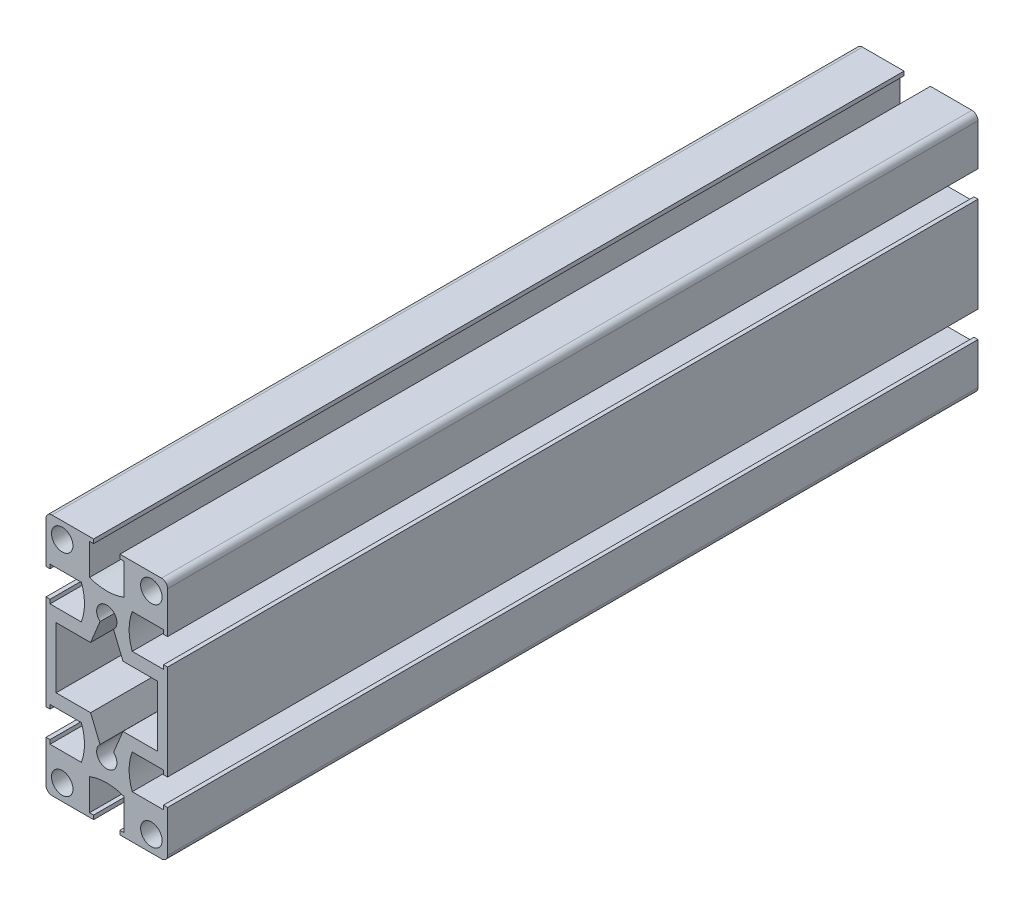
from build123d import *

# Parameters (mm, degrees)
SKETCH1_2_R                 = 2.65
EXTRUDE_1_DEPTH             = 200
HOLE_WIZARD_M5_1_AT_2_COUNT = 2
HOLE_WIZARD_M5_1_AT_2_PITCH = 30


# Read off the part's stored shape, not the designer's step: 30 x 60G x R1.5<1>
with BuildPart() as part:
    # Sketch1<2> → 凸台-拉伸1 (new body)
    with BuildSketch(Plane(origin=(1.902137601, -4.901792835, 0), x_dir=(1, 0, 0), z_dir=(0, 0, 1))):
        with BuildLine():
            Line((-3.25, 30), (-3.25, 29))
            Line((-3.25, 29), (-4.25, 29))
            Line((-4.25, 29), (-4.25, 21.277812156))
            ThreePointArc((-4.25, 21.277812156), (0, 20.5), (4.25, 21.277812156))
            Line((4.25, 21.277812156), (4.25, 29))
            Line((4.25, 29), (3.25, 29))
            Line((3.25, 29), (3.25, 30))
            Line((3.25, 30), (13.5, 30))
            ThreePointArc((13.5, 30), (14.560660172, 29.560660172), (15, 28.5))
            Line((15, 28.5), (15, 18.25))
            Line((15, 18.25), (14, 18.25))
            Line((14, 18.25), (14, 19.25))
            Line((14, 19.25), (6.277812156, 19.25))
            ThreePointArc((6.277812156, 19.25), (5.5, 15), (6.277812156, 10.75))
            Line((6.277812156, 10.75), (14, 10.75))
            Line((14, 10.75), (14, 11.75))
            Line((14, 11.75), (15, 11.75))
            Line((15, 11.75), (15, -11.75))
            Line((15, -11.75), (14, -11.75))
            Line((14, -11.75), (14, -10.75))
            Line((14, -10.75), (6.277812156, -10.75))
            ThreePointArc((6.277812156, -10.75), (5.5, -15), (6.277812156, -19.25))
            Line((6.277812156, -19.25), (14, -19.25))
            Line((14, -19.25), (14, -18.25))
            Line((14, -18.25), (15, -18.25))
            Line((15, -18.25), (15, -28.5))
            ThreePointArc((15, -28.5), (14.560660172, -29.560660172), (13.5, -30))
            Line((13.5, -30), (3.25, -30))
            Line((3.25, -30), (3.25, -29))
            Line((3.25, -29), (4.25, -29))
            Line((4.25, -29), (4.25, -21.277812156))
            ThreePointArc((4.25, -21.277812156), (0, -20.5), (-4.25, -21.277812156))
            Line((-4.25, -21.277812156), (-4.25, -29))
            Line((-4.25, -29), (-3.25, -29))
            Line((-3.25, -29), (-3.25, -30))
            Line((-3.25, -30), (-13.5, -30))
            ThreePointArc((-13.5, -30), (-14.560660172, -29.560660172), (-15, -28.5))
            Line((-15, -28.5), (-15, -18.25))
            Line((-15, -18.25), (-14, -18.25))
            Line((-14, -18.25), (-14, -19.25))
            Line((-14, -19.25), (-6.277812156, -19.25))
            ThreePointArc((-6.277812156, -19.25), (-5.5, -15), (-6.277812156, -10.75))
            Line((-6.277812156, -10.75), (-14, -10.75))
            Line((-14, -10.75), (-14, -11.75))
            Line((-14, -11.75), (-15, -11.75))
            Line((-15, -11.75), (-15, 11.75))
            Line((-15, 11.75), (-14, 11.75))
            Line((-14, 11.75), (-14, 10.75))
            Line((-14, 10.75), (-6.277812156, 10.75))
            ThreePointArc((-6.277812156, 10.75), (-5.5, 15), (-6.277812156, 19.25))
            Line((-6.277812156, 19.25), (-14, 19.25))
            Line((-14, 19.25), (-14, 18.25))
            Line((-14, 18.25), (-15, 18.25))
            Line((-15, 18.25), (-15, 28.5))
            ThreePointArc((-15, 28.5), (-14.560660172, 29.560660172), (-13.5, 30))
            Line((-13.5, 30), (-3.25, 30))
        make_face()
        with Locations((-11, 26)):
            Circle(SKETCH1_2_R, mode=Mode.SUBTRACT)
        with Locations(Location((11, 26, 0), (0, 0, 180))):
            Circle(SKETCH1_2_R, mode=Mode.SUBTRACT)
        with Locations((11, -26)):
            Circle(SKETCH1_2_R, mode=Mode.SUBTRACT)
        with Locations(Location((-11, -26, 0), (0, 0, 180))):
            Circle(SKETCH1_2_R, mode=Mode.SUBTRACT)
        with BuildLine():
            Line((-12.5, 7.5), (-4, 7.5))
            Line((-4, 7.5), (-1.665625283, 13.135679101))
            ThreePointArc((-1.665625283, 13.135679101), (0, 17.5), (1.665625283, 13.135679101))
            Line((1.665625283, 13.135679101), (4, 7.5))
            Line((4, 7.5), (12.5, 7.5))
            Line((12.5, 7.5), (12.5, -7.5))
            Line((12.5, -7.5), (4, -7.5))
            Line((4, -7.5), (1.665625283, -13.135679101))
            ThreePointArc((1.665625283, -13.135679101), (0, -17.5), (-1.665625283, -13.135679101))
            Line((-1.665625283, -13.135679101), (-4, -7.5))
            Line((-4, -7.5), (-12.5, -7.5))
            Line((-12.5, -7.5), (-12.5, 7.5))
        make_face(mode=Mode.SUBTRACT)
    extrude(amount=EXTRUDE_1_DEPTH)

    # 草图4 → M5 螺纹孔1 (revolve, cut)
    with BuildSketch(Plane(origin=(-13.097862399, -4.901792835, 45), x_dir=(0, 0, 1), z_dir=(0, 1, 0))):
        Polygon((0, 0), (0, 2.5), (2.1, 2.5), (2.1, 0.425), (2.525, 0), align=None)
    hole_wizard_m5_1 = revolve(axis=Axis((-19.447862399, -4.901792835, 45), (1, 0, 0)), mode=Mode.SUBTRACT)

    # M5 螺纹孔1 at 2: M5 螺纹孔1 ×2
    with Locations(*[(0, 0, -i * HOLE_WIZARD_M5_1_AT_2_PITCH) for i in range(1, HOLE_WIZARD_M5_1_AT_2_COUNT)]):
        add(hole_wizard_m5_1, mode=Mode.SUBTRACT)


solid = part.part
